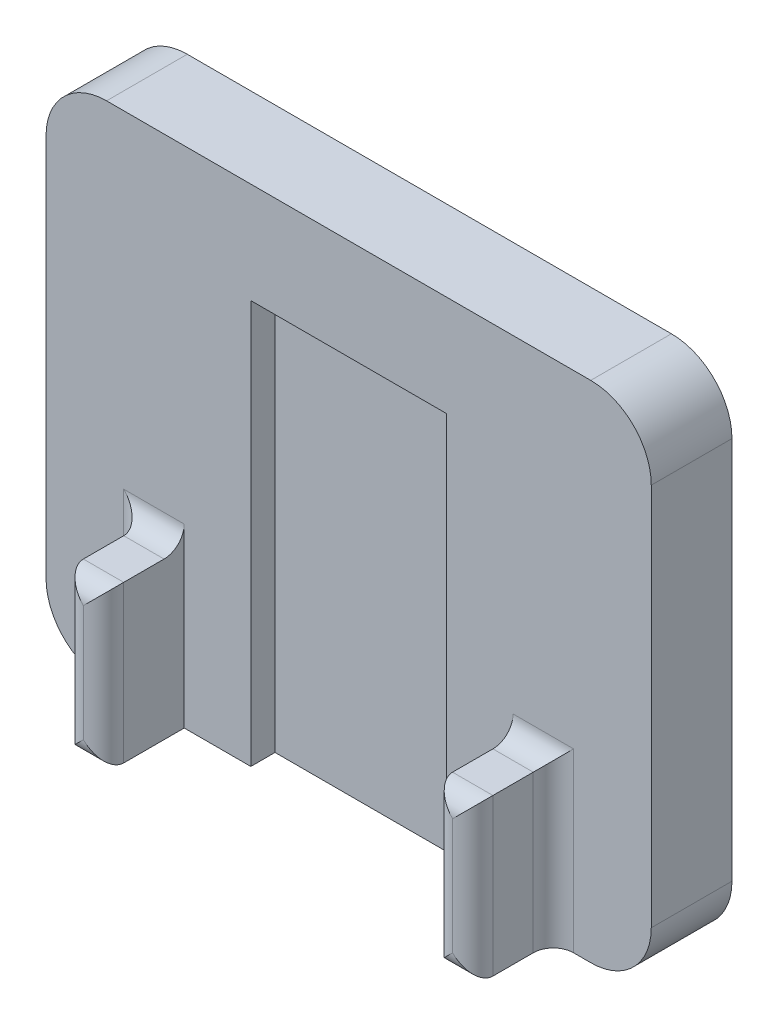
from build123d import *

# Parameters (mm, degrees)
SKETCH1_W           = 30
SKETCH1_H           = 25
BOSS_EXTRUDE1_DEPTH = 4
SKETCH3_W           = 9.7
SKETCH3_H           = 20
CUT_EXTRUDE1_DEPTH  = 1.2
FILLET1_R           = 3
SKETCH4_W           = 2
SKETCH4_H           = 7.755081554
BOSS_EXTRUDE2_DEPTH = 4
FILLET2_R           = 1


with BuildPart() as part:
    # Sketch1 → Boss-Extrude1 (new body)
    with BuildSketch(Plane.XY):
        with Locations((15, 12.5)):
            Rectangle(SKETCH1_W, SKETCH1_H)
    extrude(amount=BOSS_EXTRUDE1_DEPTH)

    # Sketch3 → Cut-Extrude1 (cut)
    with BuildSketch(Plane.XY.offset(4)):
        with Locations((15, 10)):
            Rectangle(SKETCH3_W, SKETCH3_H)
    extrude(amount=-CUT_EXTRUDE1_DEPTH, mode=Mode.SUBTRACT)

    # Fillet1
    fillet1_edges = [part.edges().sort_by_distance(p)[0] for p in [
        (0, 25, 2),
        (30, 25, 2),
        (30, 0, 2),
        (0, 0, 2),
    ]]
    fillet(fillet1_edges, radius=FILLET1_R)

    # Sketch4 → Boss-Extrude2 (add)
    with BuildSketch(Plane.XY.offset(4)):
        with Locations((24.15, 3.877540777)):
            Rectangle(SKETCH4_W, SKETCH4_H)
        with Locations((5.85, 3.877540777)):
            Rectangle(SKETCH4_W, SKETCH4_H)
    extrude(amount=BOSS_EXTRUDE2_DEPTH)

    # Fillet2
    fillet2_edges = [part.edges().sort_by_distance(p)[0] for p in [
        (25.15, 3.877540777, 4),
        (24.15, 7.755081554, 4),
        (23.15, 3.877540777, 8),
        (24.15, 0, 8),
        (25.15, 3.877540777, 8),
        (24.15, 7.755081554, 8),
        (5.85, 7.755081554, 4),
        (4.85, 3.877540777, 4),
        (6.85, 3.877540777, 8),
        (5.85, 7.755081554, 8),
        (4.85, 3.877540777, 8),
        (5.85, 0, 8),
    ]]
    fillet(fillet2_edges, radius=FILLET2_R - 0.0001)  # a hair under: the kernel refuses the full size


solid = part.part
